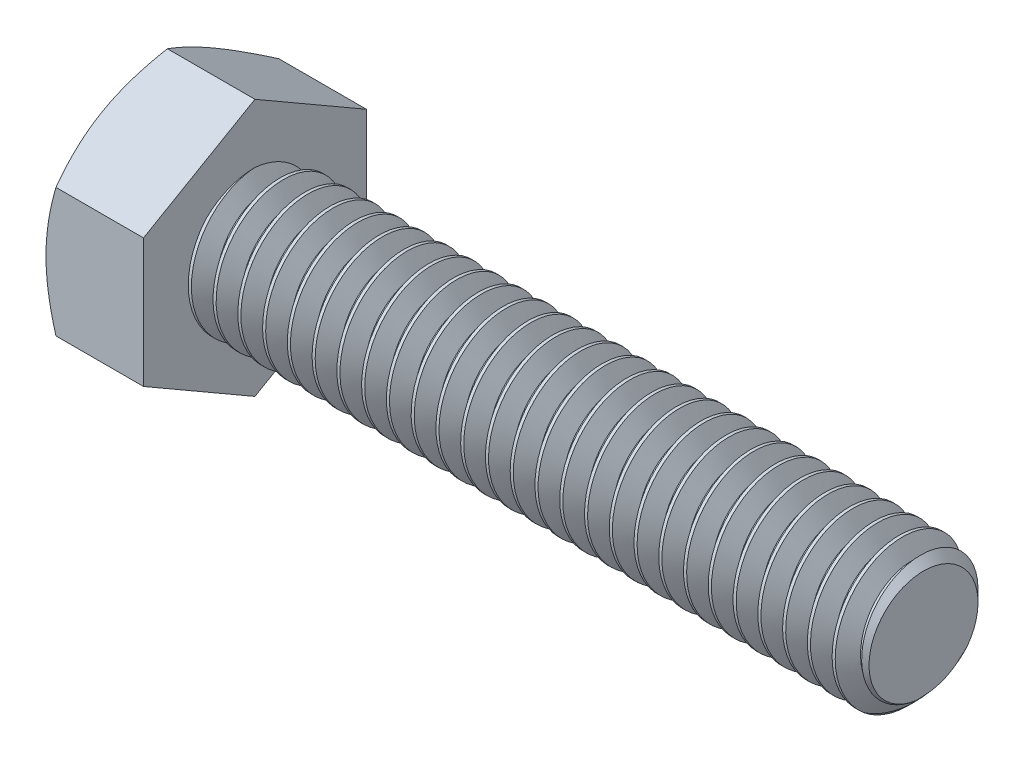
from build123d import *

# Parameters (mm, degrees)
SKETCH5_R           = 3.96875
BOSS_EXTRUDE3_DEPTH = 38.1
CHAMFER1_SIZE       = 0.8636
CUT_SWEEP1_PITCH    = 1.411111111
BOSS_EXTRUDE4_DEPTH = 5.55625
SKETCH8_OUTSIDE_W   = 182.636
SKETCH8_OUTSIDE_H   = 184.6
SKETCH8_OUTSIDE_R   = 6.35
CUT_EXTRUDE3_DEPTH  = 45.720845351
CUT_EXTRUDE3_DRAFT  = -60
CUT_EXTRUDE4_DEPTH  = 0.254
CIRPATTERN1_COUNT   = 3


with BuildPart() as part:
    # Sketch5 → Boss-Extrude3 (new body)
    with BuildSketch(Plane(origin=(21.828125, 0, 0), x_dir=(0, 0, -1), z_dir=(1, 0, 0))):
        Circle(SKETCH5_R)
    extrude(amount=-BOSS_EXTRUDE3_DEPTH)

    # Chamfer1
    chamfer1_edges = [part.edges().sort_by_distance(p)[0] for p in [
        (21.828125, 0, 3.96875),
    ]]
    chamfer(chamfer1_edges, length=CHAMFER1_SIZE)

    # Cut-Sweep1: arcs per turn and ends read off the stored shape
    # Cut-Sweep1: the profile of Sketch10 profile screwed along a right-hand helix through 28 turns, 8 arcs to a turn; built about Z, then put on its axis
    cut_sweep1_z = Axis((0, 0, 0), (0, 0, 1))
    cut_sweep1_corners = [(3.96905, 0, 0.000173205), (3.052206448, 0, -0.529166667), (3.052206448, 0, -0.705555556), (3.96905, 0, -1.234895427)]
    with BuildLine(mode=Mode.PRIVATE) as cut_sweep1_profile:
        Line(cut_sweep1_corners[0], cut_sweep1_corners[1])
        Line(cut_sweep1_corners[1], cut_sweep1_corners[2])
        Line(cut_sweep1_corners[2], cut_sweep1_corners[3])
        Line(cut_sweep1_corners[3], cut_sweep1_corners[0])
    cut_sweep1_cap = Face(cut_sweep1_profile.wire())
    cut_sweep1_turn_angles = [0, 22.5, 45, 67.5, 90, 112.5, 135, 157.5, 180, 202.5, 225, 247.5, 270, 292.5, 315, 337.5, 360]
    cut_sweep1_turn_weights = [1, 0.9238795325112867, 1, 0.9238795325112867, 1, 0.9238795325112867, 1, 0.9238795325112867, 1, 0.9238795325112867, 1, 0.9238795325112867, 1, 0.9238795325112867, 1, 0.9238795325112867, 1]
    cut_sweep1_turn_rails = [Edge.make_bspline([Vector(p[0], p[1], 0).rotate(cut_sweep1_z, cut_sweep1_turn_angles[k]) / cut_sweep1_turn_weights[k] + Vector(0, 0, p[2] + CUT_SWEEP1_PITCH * cut_sweep1_turn_angles[k] / 360) for k in range(17)], [0, 0, 0, 1, 1, 2, 2, 3, 3, 4, 4, 5, 5, 6, 6, 7, 7, 8, 8, 8], 2, cut_sweep1_turn_weights) for p in cut_sweep1_corners]
    cut_sweep1_turn_sides = [Face.make_surface_from_curves(cut_sweep1_turn_rails[p[0]], cut_sweep1_turn_rails[p[1]]) for p in [(0, 1), (1, 2), (2, 3), (3, 0)]]
    cut_sweep1 = Plane(origin=(21.828125, 0, 0), x_dir=(0, 1, 0), z_dir=(-1, 0, 0)) * Solid(Shell([*[p.moved(Location((0, 0, CUT_SWEEP1_PITCH * i))) for i in range(28) for p in cut_sweep1_turn_sides], cut_sweep1_cap, cut_sweep1_cap.rotate(cut_sweep1_z, 10080).moved(Location((0, 0, CUT_SWEEP1_PITCH * 10080 / 360)))]))
    add(cut_sweep1, mode=Mode.SUBTRACT)

    # Sketch6 → Boss-Extrude4 (add)
    with BuildSketch(Plane.ZY.offset(16.271875)):
        Polygon((6.35, 3.666174209), (0, 7.332348419), (-6.35, 3.666174209), (-6.35, -3.666174209), (0, -7.332348419), (6.35, -3.666174209), align=None)
    extrude(amount=BOSS_EXTRUDE4_DEPTH)


with BuildPart() as cut_extrude3_tool:
    # Sketch8 outside → Cut-Extrude3 (with draft: the straight prism first)
    with BuildSketch(Plane.ZY.offset(21.828125)):
        Rectangle(SKETCH8_OUTSIDE_W, SKETCH8_OUTSIDE_H)
        Circle(SKETCH8_OUTSIDE_R, mode=Mode.SUBTRACT)
    extrude(amount=-CUT_EXTRUDE3_DEPTH)
    # Cut-Extrude3: the draft: its side faces are tilted about the plane it starts from
    cut_extrude3_sides = [cut_extrude3_tool.faces().sort_by_distance(p)[0] for p in [
        (1.032297675, -92.3, 0),
        (1.032297675, 0, 91.318),
        (1.032297675, 92.3, 0),
        (1.032297675, 0, -91.318),
        (1.032297675, 0, -6.35),
    ]]
    draft(cut_extrude3_sides, Plane.ZY.offset(21.828125), CUT_EXTRUDE3_DRAFT)


with BuildPart() as part_1:
    add(part.part)

    # Cut-Extrude3: cut by cut_extrude3_tool
    add(cut_extrude3_tool.part, mode=Mode.SUBTRACT)

    # Sketch12 → Cut-Extrude4 (cut)
    with BuildSketch(Plane.ZY.offset(21.828125)):
        with BuildLine():
            Line((0.1905, 4.8895), (0.1905, 2.7305))
            ThreePointArc((0.1905, 2.7305), (0, 2.54), (-0.1905, 2.7305))
            Line((-0.1905, 2.7305), (-0.1905, 4.8895))
            ThreePointArc((-0.1905, 4.8895), (0, 5.08), (0.1905, 4.8895))
        make_face()
    cut_extrude4 = extrude(amount=-CUT_EXTRUDE4_DEPTH, mode=Mode.SUBTRACT)

    # CirPattern1: Cut-Extrude4 ×3 about axis
    cirpattern1_axis = Axis((0, 0, 0), (1, 0, 0))
    for i in range(1, CIRPATTERN1_COUNT):
        add(cut_extrude4.rotate(cirpattern1_axis, i * 360 / CIRPATTERN1_COUNT), mode=Mode.SUBTRACT)


solid = part_1.part
